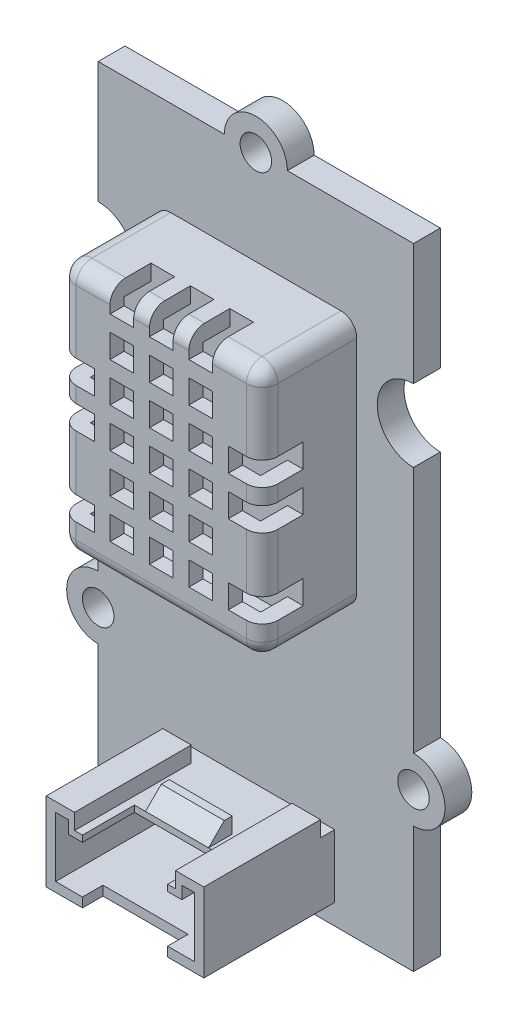
from build123d import *

# Parameters (mm, degrees)
BOSS_EXTRU_1_DEPTH      = 1.7
ESQUISSE2_R             = 1
ENL_V_MAT_EXTRU_1_DEPTH = 1.7
ESQUISSE3_W             = 10
ESQUISSE3_H             = 5
BOSS_EXTRU_2_DEPTH      = 8.3
ESQUISSE4_W             = 4
ESQUISSE4_H             = 1.5
ENL_V_MAT_EXTRU_2_DEPTH = 1
CHANFREIN1_SIZE         = 1
ESQUISSE5_W             = 5.4
ESQUISSE5_H             = 3.300987095
ENL_V_MAT_EXTRU_3_DEPTH = 1
ESQUISSE6_W             = 5.4
ESQUISSE6_H             = 1.3
ENL_V_MAT_EXTRU_4_DEPTH = 21
ENL_V_MAT_EXTRU_5_DEPTH = 7
BOSS_EXTRU_3_DEPTH      = 6
CONG_1_R                = 1
ESQUISSE9_W             = 1.5
ESQUISSE9_H             = 1.5
ENL_V_MAT_EXTRU_6_DEPTH = 2.6
ESQUISSE10_W            = 10.8
ESQUISSE10_H            = 14
ENL_V_MAT_EXTRU_8_DEPTH = 1.7


with BuildPart() as part:
    # Esquisse1 → Boss.-Extru.1 (new body)
    with BuildSketch(Plane.XY):
        with BuildLine():
            Line((-4.329488542, 15.340909091), (3.670511458, 15.340909091))
            Line((3.670511458, 15.340909091), (3.670511458, 7.640909091))
            ThreePointArc((3.670511458, 7.640909091), (1.370511458, 5.340909091), (3.670511458, 3.040909091))
            Line((3.670511458, 3.040909091), (3.670511458, -12.659090909))
            ThreePointArc((3.670511458, -12.659090909), (5.670511458, -14.659090909), (3.670511458, -16.659090909))
            Line((3.670511458, -16.659090909), (3.670511458, -24.659090909))
            Line((3.670511458, -24.659090909), (-4.029488542, -24.659090909))
            ThreePointArc((-4.029488542, -24.659090909), (-6.329488542, -22.359090909), (-8.629488542, -24.659090909))
            Line((-8.629488542, -24.659090909), (-16.329488542, -24.659090909))
            Line((-16.329488542, -24.659090909), (-16.329488542, -16.659090909))
            ThreePointArc((-16.329488542, -16.659090909), (-18.329488542, -14.659090909), (-16.329488542, -12.659090909))
            Line((-16.329488542, -12.659090909), (-16.329488542, 3.040909091))
            ThreePointArc((-16.329488542, 3.040909091), (-14.029488542, 5.340909091), (-16.329488542, 7.640909091))
            Line((-16.329488542, 7.640909091), (-16.329488542, 15.340909091))
            Line((-16.329488542, 15.340909091), (-8.329488542, 15.340909091))
            ThreePointArc((-8.329488542, 15.340909091), (-6.329488542, 17.340909091), (-4.329488542, 15.340909091))
        make_face()
    extrude(amount=BOSS_EXTRU_1_DEPTH)

    # Esquisse2 → Enlèv. mat.-Extru.1 (cut)
    with BuildSketch(Plane.XY.offset(1.7)):
        with Locations((-6.329488542, 15.340909091)):
            Circle(ESQUISSE2_R)
        with Locations((-16.329488542, -14.659090909)):
            Circle(ESQUISSE2_R)
        with Locations((3.670511458, -14.659090909)):
            Circle(ESQUISSE2_R)
    extrude(amount=-ENL_V_MAT_EXTRU_1_DEPTH, mode=Mode.SUBTRACT)

    # Esquisse3 → Boss.-Extru.2 (add)
    with BuildSketch(Plane.XY.offset(1.7)):
        with Locations((-6.329488542, -20.859090909)):
            Rectangle(ESQUISSE3_W, ESQUISSE3_H)
    extrude(amount=BOSS_EXTRU_2_DEPTH)

    # Esquisse4 → Enlèv. mat.-Extru.2 (cut)
    with BuildSketch(Plane(origin=(0, -18.359090909, 0), x_dir=(1, 0, 0), z_dir=(0, 1, 0))):
        Polygon((-11.329488542, -1.7), (-1.329488542, -1.7), (-1.329488542, -2.6), (-3.129488542, -2.6), (-3.129488542, -10), (-9.529488542, -10), (-9.529488542, -2.6), (-11.329488542, -2.6), align=None)
        with Locations((-6.329488542, -5.95)):
            Rectangle(ESQUISSE4_W, ESQUISSE4_H, mode=Mode.SUBTRACT)
    extrude(amount=-ENL_V_MAT_EXTRU_2_DEPTH, mode=Mode.SUBTRACT)

    # Chanfrein1
    chanfrein1_edges = [part.edges().sort_by_distance(p)[0] for p in [
        (-6.329488542, -18.359090909, 6.7),
    ]]
    chamfer(chanfrein1_edges, length=CHANFREIN1_SIZE - 0.0001)  # a hair under: the kernel refuses the full size

    # Esquisse5 → Enlèv. mat.-Extru.3 (cut)
    with BuildSketch(Plane(origin=(0, -19.359090909, 0), x_dir=(1, 0, 0), z_dir=(0, 1, 0))):
        with Locations((-6.329488542, -8.349506453)):
            Rectangle(ESQUISSE5_W, ESQUISSE5_H)
    extrude(amount=-ENL_V_MAT_EXTRU_3_DEPTH, mode=Mode.SUBTRACT)

    # Esquisse6 → Enlèv. mat.-Extru.4 (cut)
    with BuildSketch(Plane(origin=(0, -20.359090909, 0), x_dir=(1, 0, 0), z_dir=(0, 1, 0))):
        with Locations((-6.329488542, -9.35)):
            Rectangle(ESQUISSE6_W, ESQUISSE6_H)
    extrude(amount=-ENL_V_MAT_EXTRU_4_DEPTH, mode=Mode.SUBTRACT)

    # Esquisse7 → Enlèv. mat.-Extru.5 (cut)
    with BuildSketch(Plane.XY.offset(10)):
        Polygon((-9.929488542, -19.759090909), (-2.729488542, -19.759090909), (-2.729488542, -18.959090909), (-1.929488542, -18.959090909), (-1.929488542, -19.759090909), (-1.929488542, -22.759090909), (-10.729488542, -22.759090909), (-10.729488542, -19.759090909), (-10.729488542, -18.959090909), (-9.929488542, -18.959090909), align=None)
    extrude(amount=-ENL_V_MAT_EXTRU_5_DEPTH, mode=Mode.SUBTRACT)

    # Esquisse8 → Boss.-Extru.3 (add)
    with BuildSketch(Plane.XY.offset(1.7)):
        with BuildLine():
            Line((-11.729488542, 9.340909091), (-0.929488542, 9.340909091))
            ThreePointArc((-0.929488542, 9.340909091), (-0.22238176, 9.048015872), (0.070511458, 8.340909091))
            Line((0.070511458, 8.340909091), (0.070511458, -5.659090909))
            ThreePointArc((0.070511458, -5.659090909), (-0.22238176, -6.36619769), (-0.929488542, -6.659090909))
            Line((-0.929488542, -6.659090909), (-11.729488542, -6.659090909))
            ThreePointArc((-11.729488542, -6.659090909), (-12.436595323, -6.36619769), (-12.729488542, -5.659090909))
            Line((-12.729488542, -5.659090909), (-12.729488542, 8.340909091))
            ThreePointArc((-12.729488542, 8.340909091), (-12.436595323, 9.048015872), (-11.729488542, 9.340909091))
        make_face()
    extrude(amount=BOSS_EXTRU_3_DEPTH)

    # Congé1
    cong_1_edges = [part.edges().sort_by_distance(p)[0] for p in [
        (-12.436595323, -6.36619769, 7.7),
        (-6.329488542, -6.659090909, 7.7),
        (-0.22238176, -6.36619769, 7.7),
        (0.070511458, 1.340909091, 7.7),
        (-0.22238176, 9.048015872, 7.7),
        (-6.329488542, 9.340909091, 7.7),
        (-12.436595323, 9.048015872, 7.7),
        (-12.729488542, 1.340909091, 7.7),
    ]]
    fillet(cong_1_edges, radius=CONG_1_R)

    # Esquisse9 → Enlèv. mat.-Extru.6 (cut)
    with BuildSketch(Plane.XY.offset(7.7)):
        with Locations((-6.329488542, 8.590909091)):
            Rectangle(ESQUISSE9_W, ESQUISSE9_H)
        with Locations((-3.829488542, 8.590909091)):
            Rectangle(ESQUISSE9_W, ESQUISSE9_H)
        with Locations((-3.829488542, 6.090909091)):
            Rectangle(ESQUISSE9_W, ESQUISSE9_H)
        with Locations((-3.829488542, 3.590909091)):
            Rectangle(ESQUISSE9_W, ESQUISSE9_H)
        Polygon((-2.079488542, 4.340909091), (-0.579488542, 4.340909091), (0.070511458, 4.340909091), (0.070511458, 2.840909091), (-0.579488542, 2.840909091), (-2.079488542, 2.840909091), align=None)
        with Locations((-3.829488542, 1.090909091)):
            Rectangle(ESQUISSE9_W, ESQUISSE9_H)
        Polygon((-2.079488542, 1.840909091), (-0.579488542, 1.840909091), (0.070511458, 1.840909091), (0.070511458, 0.340909091), (-0.579488542, 0.340909091), (-2.079488542, 0.340909091), align=None)
        with Locations((-3.829488542, -1.409090909)):
            Rectangle(ESQUISSE9_W, ESQUISSE9_H)
        with Locations((-3.829488542, -3.909090909)):
            Rectangle(ESQUISSE9_W, ESQUISSE9_H)
        Polygon((-2.079488542, -3.159090909), (-0.579488542, -3.159090909), (0.070511458, -3.159090909), (0.070511458, -4.659090909), (-0.579488542, -4.659090909), (-2.079488542, -4.659090909), align=None)
        with Locations((-6.329488542, 6.090909091)):
            Rectangle(ESQUISSE9_W, ESQUISSE9_H)
        with Locations((-6.329488542, 3.590909091)):
            Rectangle(ESQUISSE9_W, ESQUISSE9_H)
        with Locations((-6.329488542, 1.090909091)):
            Rectangle(ESQUISSE9_W, ESQUISSE9_H)
        with Locations((-6.329488542, -1.409090909)):
            Rectangle(ESQUISSE9_W, ESQUISSE9_H)
        with Locations((-6.329488542, -3.909090909)):
            Rectangle(ESQUISSE9_W, ESQUISSE9_H)
        with Locations((-8.829488542, 8.590909091)):
            Rectangle(ESQUISSE9_W, ESQUISSE9_H)
        with Locations((-8.829488542, 6.090909091)):
            Rectangle(ESQUISSE9_W, ESQUISSE9_H)
        with Locations((-8.829488542, 3.590909091)):
            Rectangle(ESQUISSE9_W, ESQUISSE9_H)
        with Locations((-8.829488542, 1.090909091)):
            Rectangle(ESQUISSE9_W, ESQUISSE9_H)
        with Locations((-8.829488542, -1.409090909)):
            Rectangle(ESQUISSE9_W, ESQUISSE9_H)
        with Locations((-8.829488542, -3.909090909)):
            Rectangle(ESQUISSE9_W, ESQUISSE9_H)
        Polygon((-12.079488542, 4.340909091), (-10.579488542, 4.340909091), (-10.579488542, 2.840909091), (-12.079488542, 2.840909091), (-12.729488542, 2.840909091), (-12.729488542, 4.340909091), align=None)
        Polygon((-12.079488542, 1.840909091), (-10.579488542, 1.840909091), (-10.579488542, 0.340909091), (-12.079488542, 0.340909091), (-12.729488542, 0.340909091), (-12.729488542, 1.840909091), align=None)
        Polygon((-12.079488542, -3.159090909), (-10.579488542, -3.159090909), (-10.579488542, -4.659090909), (-12.079488542, -4.659090909), (-12.729488542, -4.659090909), (-12.729488542, -3.159090909), align=None)
    extrude(amount=-ENL_V_MAT_EXTRU_6_DEPTH, mode=Mode.SUBTRACT)

    # Esquisse10 → Enlèv. mat.-Extru.8 (cut)
    with BuildSketch(Plane.XY.offset(5.1)):
        with Locations((-6.329488542, 1.340909091)):
            Rectangle(ESQUISSE10_W, ESQUISSE10_H)
    extrude(amount=ENL_V_MAT_EXTRU_8_DEPTH, mode=Mode.SUBTRACT)


solid = part.part
